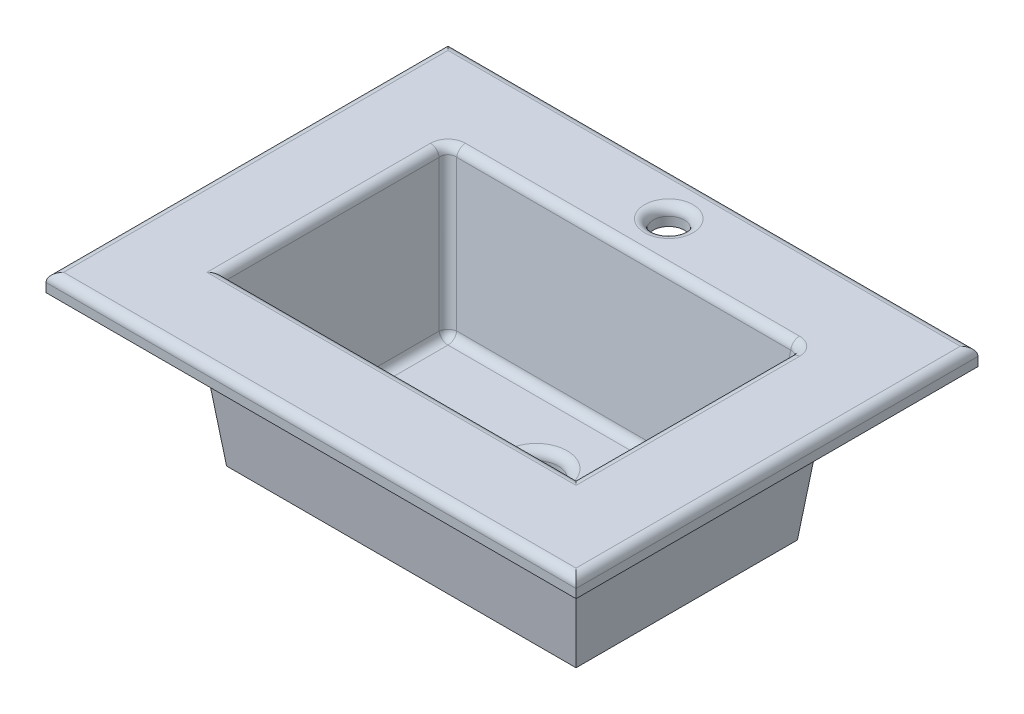
from build123d import *

# Parameters (mm, degrees)
SKETCH_1_W          = 600
SKETCH_1_H          = 455
EXTRUDE_1_DEPTH     = 195
LOFT_1_OUTLINE_W    = 360
LOFT_1_OUTLINE_H    = 215
LOFT_1_DEPTH        = 170
LOFT_1_DRAFT        = -6.7098368
SHELL_1_T           = -20
SKETCH_3_R          = 25
SKETCH_3_R_2        = 17.5
CUT_EXTRUDE_2_DEPTH = 777.61122835
FILLET_1_R          = 10


# Read off the part's stored shape, not the designer's step: Вырез-По сечениям1
with BuildPart() as part:
    # Эскиз1 → Бобышка-Вытянуть1 (new body)
    with BuildSketch(Plane(origin=(0, 0, 0), x_dir=(1, 0, 0), z_dir=(0, 1, 0))):
        with Locations((300, 227.5)):
            Rectangle(SKETCH_1_W, SKETCH_1_H)
    extrude(amount=EXTRUDE_1_DEPTH)


with BuildPart() as loft_1_tool:
    # Вырез-По сечениям1 outline → Вырез-По сечениям1 (with draft: the straight prism first)
    with BuildSketch(Plane(origin=(0, 25, 0), x_dir=(1, 0, 0), z_dir=(0, 1, 0))):
        with Locations((300, 227.5)):
            Rectangle(LOFT_1_OUTLINE_W, LOFT_1_OUTLINE_H)
    extrude(amount=LOFT_1_DEPTH)
    # Вырез-По сечениям1: the draft: its side faces are tilted about the plane it starts from
    loft_1_sides = [loft_1_tool.faces().sort_by_distance(p)[0] for p in [
        (480, 110, -227.5),
        (300, 110, -335),
        (120, 110, -227.5),
        (300, 110, -120),
    ]]
    draft(loft_1_sides, Plane(origin=(0, 25, 0), x_dir=(1, 0, 0), z_dir=(0, 1, 0)), LOFT_1_DRAFT)


with BuildPart() as part_1:
    add(part.part)

    # Вырез-По сечениям1: cut by loft_1_tool
    add(loft_1_tool.part, mode=Mode.SUBTRACT)

    # Оболочка1
    shell_1_openings = [part_1.faces().sort_by_distance(p)[0] for p in [
        (300, 97.5, 0),
        (0, 97.5, -227.5),
        (600, 97.5, -227.5),
        (300, 0, -227.5),
        (300, 97.5, -455),
    ]]
    offset(amount=SHELL_1_T, openings=shell_1_openings, kind=Kind.INTERSECTION)

    # Эскиз3 → Вырез-Вытянуть2 (cut, through all)
    with BuildSketch(Plane(origin=(0, 195, 0), x_dir=(-1, 0, 0), z_dir=(0, 1, 0))):
        with Locations(Location((-300, -255, 0), (0, 0, 90))):
            Circle(SKETCH_3_R)
        with Locations(Location((-300, -405, 0), (0, 0, 90))):
            Circle(SKETCH_3_R_2)
    extrude(amount=-CUT_EXTRUDE_2_DEPTH, mode=Mode.SUBTRACT)

    # Скругление1
    fillet_1_edges = [part_1.edges().sort_by_distance(p)[0] for p in [
        (300, 195, -455),
        (600, 195, -227.5),
        (300, 195, 0),
        (0, 195, -227.5),
        (100.000000023, 195, -227.5),
        (300, 195, -100.000000023),
        (499.999999977, 195, -227.5),
        (300, 195, -422.5),
        (110.000000012, 110, -344.999999988),
        (300, 195, -354.999999977),
        (489.999999988, 110, -344.999999988),
        (300, 25, -120),
        (120, 25, -227.5),
        (300, 25, -335),
        (480, 25, -227.5),
        (300, 25, -280),
    ]]
    fillet(fillet_1_edges, radius=FILLET_1_R)


solid = part_1.part
